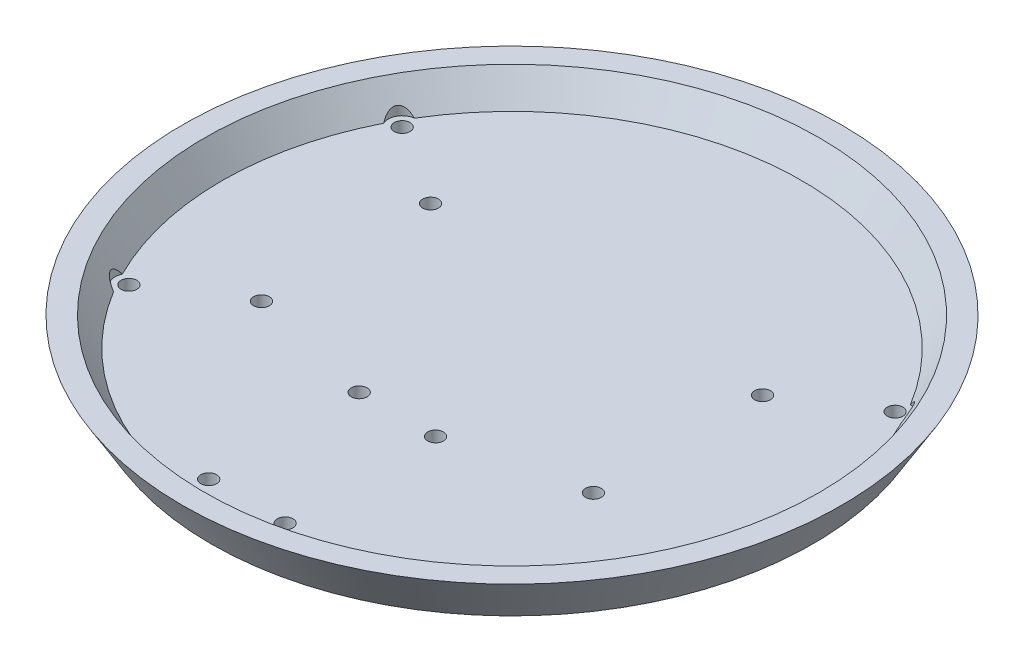
from build123d import *

# Parameters (mm, degrees)
SKETCH4_R          = 1.65
CUT_EXTRUDE1_DEPTH = 98.765024421
SKETCH5_R          = 2.9
CUT_EXTRUDE2_DEPTH = 98.765024421
SKETCH6_R          = 1.65
CUT_EXTRUDE3_DEPTH = 98.765024427


with BuildPart() as part:
    # Sketch1 → Revolve1 (revolve)
    with BuildSketch(Plane.XY):
        Polygon((0, -4), (63, -4), (69, 6), (64.335238484, 6), (60.735238484, 0), (0, 0), align=None)
    revolve(axis=Axis((0, -4, 0), (0, 1, 0)))

    # Sketch4 → Cut-Extrude1 (cut, through all)
    with BuildSketch(Plane(origin=(0, 0, 0), x_dir=(1, 0, 0), z_dir=(0, 1, 0))):
        with Locations((34.749254443, 17.70562949)):
            Circle(SKETCH4_R)
        with Locations((51.602562721, 28.603767595)):
            Circle(SKETCH4_R)
        with Locations((51.602562721, -28.603767595)):
            Circle(SKETCH4_R)
        with Locations((34.749254443, -17.70562949)):
            Circle(SKETCH4_R)
        with Locations((-34.749254443, -17.70562949)):
            Circle(SKETCH4_R)
        with Locations((-51.602562721, -28.603767595)):
            Circle(SKETCH4_R)
        with Locations((-51.602562721, 28.603767595)):
            Circle(SKETCH4_R)
        with Locations((-34.749254443, 17.70562949)):
            Circle(SKETCH4_R)
    extrude(amount=-CUT_EXTRUDE1_DEPTH, mode=Mode.SUBTRACT)

    # Sketch5 → Cut-Extrude2 (cut, through all)
    with BuildSketch(Plane(origin=(0, 0, 0), x_dir=(1, 0, 0), z_dir=(0, 1, 0))):
        with Locations((51.602562721, 28.603767595)):
            Circle(SKETCH5_R)
        with Locations((51.602562721, -28.603767595)):
            Circle(SKETCH5_R)
        with Locations((-51.602562721, -28.603767595)):
            Circle(SKETCH5_R)
        with Locations((-51.602562721, 28.603767595)):
            Circle(SKETCH5_R)
    extrude(amount=CUT_EXTRUDE2_DEPTH, mode=Mode.SUBTRACT)

    # Sketch6 → Cut-Extrude3 (cut, through all)
    with BuildSketch(Plane(origin=(0, 0, 0), x_dir=(1, 0, 0), z_dir=(0, 1, 0))):
        with Locations((8, -55.5)):
            Circle(SKETCH6_R)
        with Locations((-8, -55.5)):
            Circle(SKETCH6_R)
        with Locations((8, -24)):
            Circle(SKETCH6_R)
        with Locations((-8, -24)):
            Circle(SKETCH6_R)
    extrude(amount=-CUT_EXTRUDE3_DEPTH, mode=Mode.SUBTRACT)


solid = part.part
